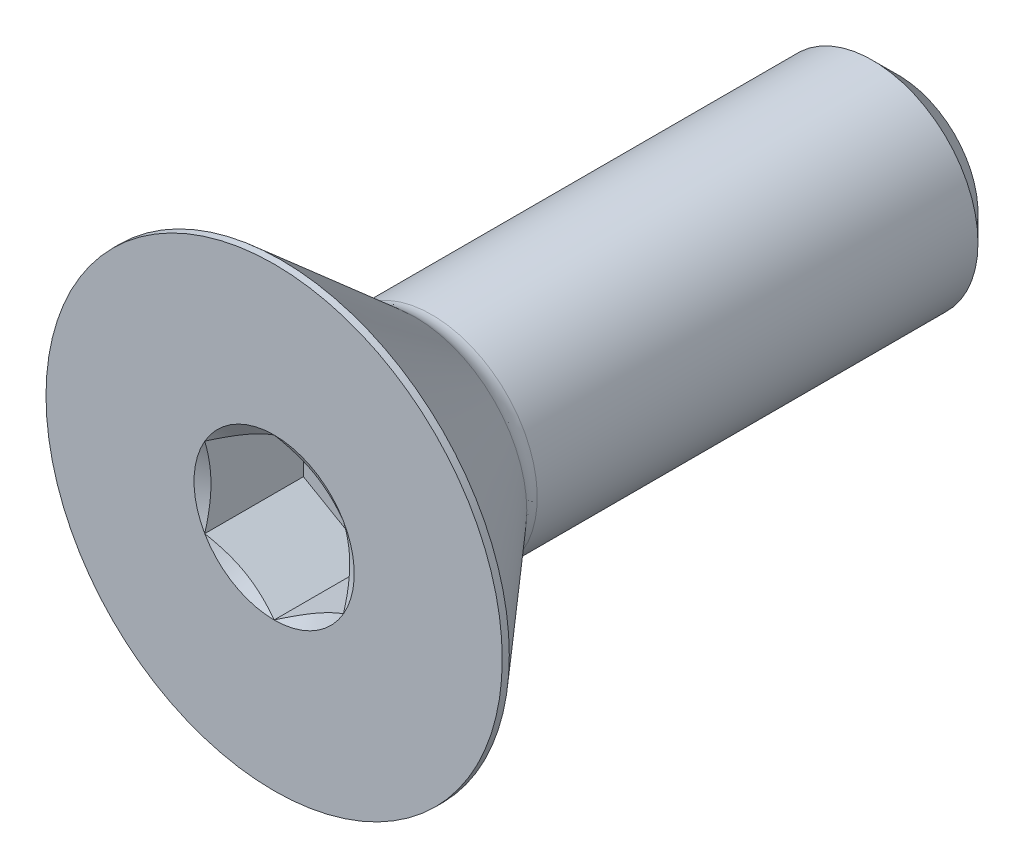
from build123d import *

# Parameters (mm, degrees)
SKETCH1_W          = 14.2875
SKETCH1_H          = 2.413
CHAMFER1_SIZE      = 0.5953125
CUT_EXTRUDE2_DEPTH = 2.25806


with BuildPart() as part:
    # Sketch1 → Revolve1 (revolve)
    with BuildSketch(Plane(origin=(0, 0, 0), x_dir=(0, 0, -1), z_dir=(1, 0, 0))):
        with Locations((7.14375, 1.2065)):
            Rectangle(SKETCH1_W, SKETCH1_H)
    revolve(axis=Axis((0, 0, -14.2875), (0, 0, 1)))

    # Chamfer1
    chamfer1_edges = [part.edges().sort_by_distance(p)[0] for p in [
        (0, -2.413, -14.2875),
    ]]
    chamfer(chamfer1_edges, length=CHAMFER1_SIZE)

    # Sketch7 → Revolve2 (revolve)
    with BuildSketch(Plane(origin=(0, 0, 0), x_dir=(0, 0, -1), z_dir=(1, 0, 0))):
        with BuildLine():
            Line((0, 5.2197), (0.16129, 5.2197))
            Line((0.16129, 5.2197), (3.2258, 2.555762099))
            ThreePointArc((3.2258, 2.555762099), (3.403809493, 2.44985758), (3.607634579, 2.413))
            Line((3.607634579, 2.413), (3.607634579, 0))
            Line((3.607634579, 0), (0, 0))
            Line((0, 0), (0, 5.2197))
        make_face()
    revolve(axis=Axis((0, 0, 0), (0, 0, -1)))

    # Sketch5 → Cut-Extrude2 (cut)
    with BuildSketch(Plane.XY):
        Polygon((0, 1.833087105), (-1.5875, 0.916543552), (-1.5875, -0.916543552), (0, -1.833087105), (1.5875, -0.916543552), (1.5875, 0.916543552), align=None)
    extrude(amount=-CUT_EXTRUDE2_DEPTH, mode=Mode.SUBTRACT)

    # Cut-Extrude3 cone 1 section (through the dimple's axis) → Cut-Extrude3 (revolve, cut)
    with BuildSketch(Plane(origin=(0, 0, 0), x_dir=(0, -1, 0), z_dir=(1, 0, 0))):
        Polygon((0, 0), (1.833087105, 0), (0, 1.058333333), align=None)
    revolve(axis=Axis((0, 0, 0), (0, 0, -1)), mode=Mode.SUBTRACT)


solid = part.part
